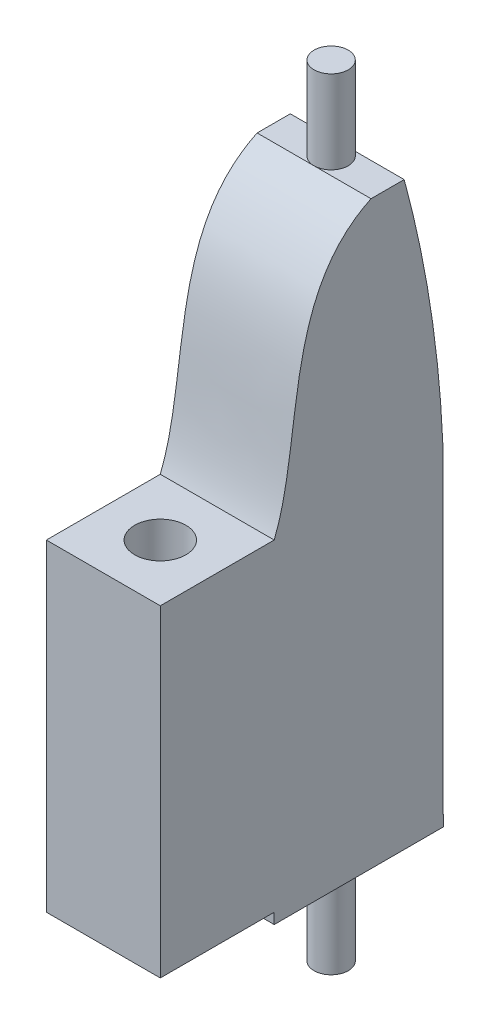
from build123d import *

# Parameters (mm, degrees)
CUT_EXTRUDE_START     = -10
CUT_EXTRUDE_1_DEPTH   = 10
EXTRUDE_START         = -250
SKETCH_3_R            = 50
SKETCH_3_R_2          = 32.5
EXTRUDE_1_DEPTH       = 250
EXTRUDE_7_DEPTH       = 250
EXTRUDE_8_DEPTH       = 50
EXTRUDE_8_DEPTH_BACK  = 50
SKETCH_5_R            = 4.77
CUT_EXTRUDE_2_DEPTH   = 9.525
CUT_EXTRUDE_5_DEPTH   = 33
SKETCH_12_W           = 100
SKETCH_12_H           = 500
EXTRUDE_10_DEPTH      = 148
EXTRUDE_12_DEPTH      = 73
EXTRUDE_12_DEPTH_BACK = 612
SKETCH_13_R           = 15
CUT_EXTRUDE_4_DEPTH   = 239
SKETCH_16_W           = 100
SKETCH_16_H           = 148.739556464
EXTRUDE_15_DEPTH      = 9.398


with BuildPart() as part:
    # 草图1 → 旋转1 (revolve)
    with BuildSketch(Plane.XY):
        Polygon((16.5, 10), (1, 10), (1, 102), (0, 102), (0, 250), (-10, 250), (-10, 0), (16.5, 0), align=None)
        Polygon((28.5, 10), (28.5, 0), (55, 0), (55, 250), (45, 250), (45, 102), (44, 102), (44, 10), align=None)
    revolve(axis=Axis((22.5, 0, 0), (0, 1, 0)))

    # 草图2 → 切除-拉伸1 (cut)
    with BuildSketch(Plane.XZ.offset(CUT_EXTRUDE_START)):
        with BuildLine():
            Line((30.2, 2), (28.156854249, 2))
            ThreePointArc((28.156854249, 2), (28.5, 0), (28.156854249, -2))
            Line((28.156854249, -2), (30.2, -2))
            Line((30.2, -2), (30.2, 2))
        make_face()
    extrude(amount=CUT_EXTRUDE_1_DEPTH, mode=Mode.SUBTRACT)

    # 草图3 → 凸台-拉伸1 (add)
    with BuildSketch(Plane(origin=(0, 250, 0), x_dir=(1, 0, 0), z_dir=(0, 1, 0)).offset(EXTRUDE_START)):
        with Locations((22.5, 0)):
            Circle(SKETCH_3_R)
        with Locations((22.5, 0)):
            Circle(SKETCH_3_R_2, mode=Mode.SUBTRACT)
    extrude(amount=EXTRUDE_1_DEPTH)

    # 草图3<5> → 凸台-拉伸7 (add)
    with BuildSketch(Plane(origin=(0, 250, 0), x_dir=(1, 0, 0), z_dir=(0, 1, 0)).offset(EXTRUDE_START)):
        with BuildLine():
            ThreePointArc((22.5, -50), (-12.855339059, -35.355339059), (-27.5, 0))
            Line((-27.5, 0), (-27.5, -50))
            Line((-27.5, -50), (22.5, -50))
        make_face()
        with BuildLine():
            Line((-27.5, 50), (-27.5, 0))
            ThreePointArc((-27.5, 0), (-12.855339059, 35.355339059), (22.5, 50))
            Line((22.5, 50), (-27.5, 50))
        make_face()
        with BuildLine():
            Line((72.5, 50), (22.5, 50))
            ThreePointArc((22.5, 50), (57.855339059, 35.355339059), (72.5, 0))
            Line((72.5, 0), (72.5, 50))
        make_face()
        with BuildLine():
            ThreePointArc((72.5, 0), (57.855339059, -35.355339059), (22.5, -50))
            Line((22.5, -50), (72.5, -50))
            Line((72.5, -50), (72.5, 0))
        make_face()
    extrude(amount=EXTRUDE_7_DEPTH)

    # 草图1<21> → 凸台-拉伸8 (add, two sides: drawn at the far end of the back side and taken through both)
    with BuildSketch(Plane.XY.offset(-EXTRUDE_8_DEPTH_BACK)):
        Polygon((16.5, 0), (0, 0), (-10, 0), (-27.5, 0), (-27.5, -33), (72.5, -33), (72.5, 0), (55, 0), (45, 0), (28.5, 0), align=None)
    extrude(amount=EXTRUDE_8_DEPTH + EXTRUDE_8_DEPTH_BACK)

    # 草图5 → 切除-拉伸2 (cut)
    with BuildSketch(Plane.XZ.offset(33)):
        with Locations((-16.030339059, 0)):
            Circle(SKETCH_5_R)
        with Locations((-4.74506403, 27.24506403)):
            Circle(SKETCH_5_R)
        with Locations((22.5, 38.530339059)):
            Circle(SKETCH_5_R)
        with Locations((49.74506403, 27.24506403)):
            Circle(SKETCH_5_R)
        with Locations((61.030339059, 0)):
            Circle(SKETCH_5_R)
        with Locations((49.74506403, -27.24506403)):
            Circle(SKETCH_5_R)
        with Locations((22.5, -38.530339059)):
            Circle(SKETCH_5_R)
        with Locations((-4.74506403, -27.24506403)):
            Circle(SKETCH_5_R)
    extrude(amount=-CUT_EXTRUDE_2_DEPTH, mode=Mode.SUBTRACT)

    # 草图7 → 切除-拉伸5 (cut)
    with BuildSketch(Plane.XZ.offset(33)):
        Polygon((44.97506403, 22.47506403), (41.715776468, 22.47506403), (41.715776468, 32.096637168), (4.999147853, 32.096637168), (4.999147853, 22.47506403), (0.02493597, 22.47506403), (0.02493597, 16.827462287), (-10.005243648, 16.827462287), (-10.005243648, -14.505237612), (0.02493597, -14.505237612), (0.02493597, -22.47506403), (4.116536589, -22.47506403), (4.116536589, -31.627896149), (41.715776468, -31.627896149), (41.715776468, -22.47506403), (44.97506403, -22.47506403), (44.97506403, -15.917415636), (54.601900934, -15.917415636), (54.601900934, 17.26876792), (44.97506403, 17.26876792), align=None)
    extrude(amount=-CUT_EXTRUDE_5_DEPTH, mode=Mode.SUBTRACT)

    # 草图12 → 凸台-拉伸10 (add)
    with BuildSketch(Plane(origin=(0, 0, -50), x_dir=(-1, 0, 0), z_dir=(0, 0, -1))):
        with Locations((-22.5, 217)):
            Rectangle(SKETCH_12_W, SKETCH_12_H)
    extrude(amount=EXTRUDE_10_DEPTH)

    # 草图13 → 凸台-拉伸12 (add, two sides: drawn at the far end of the back side and taken through both)
    with BuildSketch(Plane(origin=(0, 467, 0), x_dir=(1, 0, 0), z_dir=(0, 1, 0)).offset(-EXTRUDE_12_DEPTH_BACK)):
        with Locations((22.5, 150)):
            Circle(SKETCH_13_R)
    extrude(amount=EXTRUDE_12_DEPTH + EXTRUDE_12_DEPTH_BACK)

    # 草图14 → 切除-拉伸4 (cut)
    with BuildSketch(Plane(origin=(72.5, 0, 0), x_dir=(0, 0, -1), z_dir=(1, 0, 0))):
        with BuildLine():
            Line((50, 250), (50, 467))
            Line((50, 467), (135, 467))
            add(Edge.make_bspline(
                [(50, 250), (76.315551246, 314.396639374), (56.559615793, 429.68013341), (135, 467)],
                knots=[0, 0, 0, 0, 1, 1, 1, 1], degree=3))
        make_face()
        with BuildLine():
            Line((164.121808583, 467), (198, 467))
            Line((198, 467), (198, 250))
            add(Edge.make_bspline(
                [(164.121808583, 467), (193.074894333, 360.435548365), (198, 250)],
                knots=[0, 0, 0, 1, 1, 1], degree=2))
        make_face()
    extrude(amount=-CUT_EXTRUDE_4_DEPTH, mode=Mode.SUBTRACT)

    # 草图16 → 凸台-拉伸15 (add)
    with BuildSketch(Plane.XZ.offset(33)):
        with Locations((22.5, -124.369778232)):
            Rectangle(SKETCH_16_W, SKETCH_16_H)
    extrude(amount=EXTRUDE_15_DEPTH)


solid = part.part
